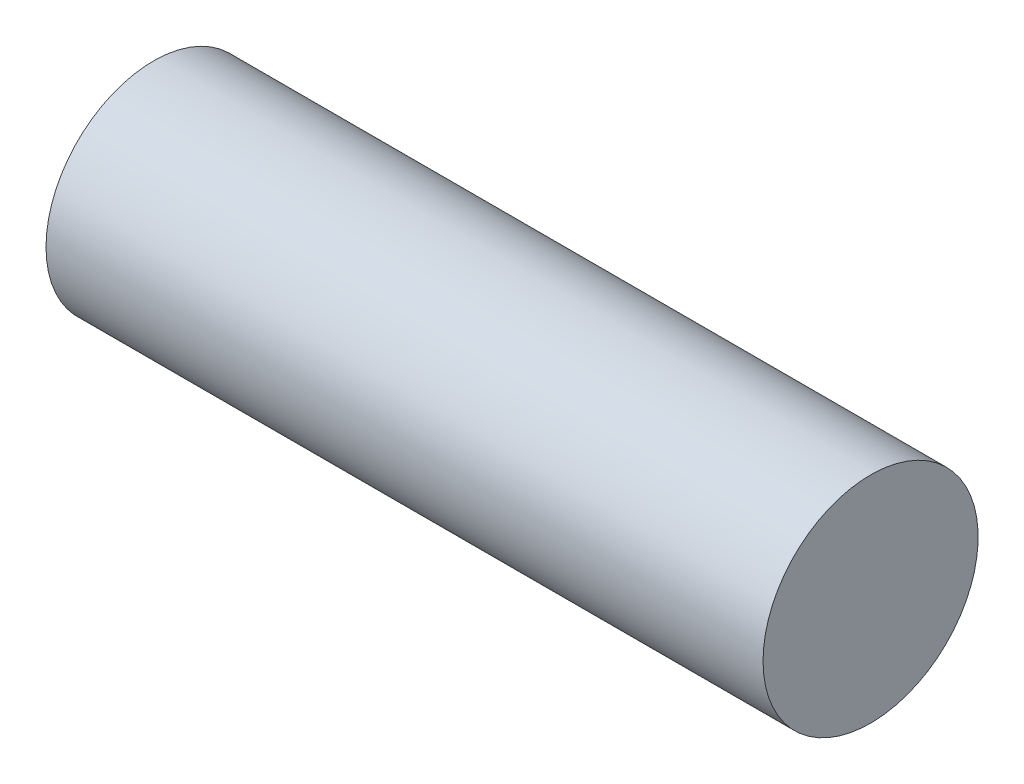
from build123d import *

# Parameters (mm, degrees)
PIN_INNER_SKETCH_W = 20
PIN_INNER_SKETCH_H = 3


with BuildPart() as part:
    # Pin_Inner Sketch → Pin_Inner (revolve)
    with BuildSketch(Plane.XY):
        with Locations((80, 1.5)):
            Rectangle(PIN_INNER_SKETCH_W, PIN_INNER_SKETCH_H)
    revolve(axis=Axis((-1000, 0, 0), (1, 0, 0)))


solid = part.part
